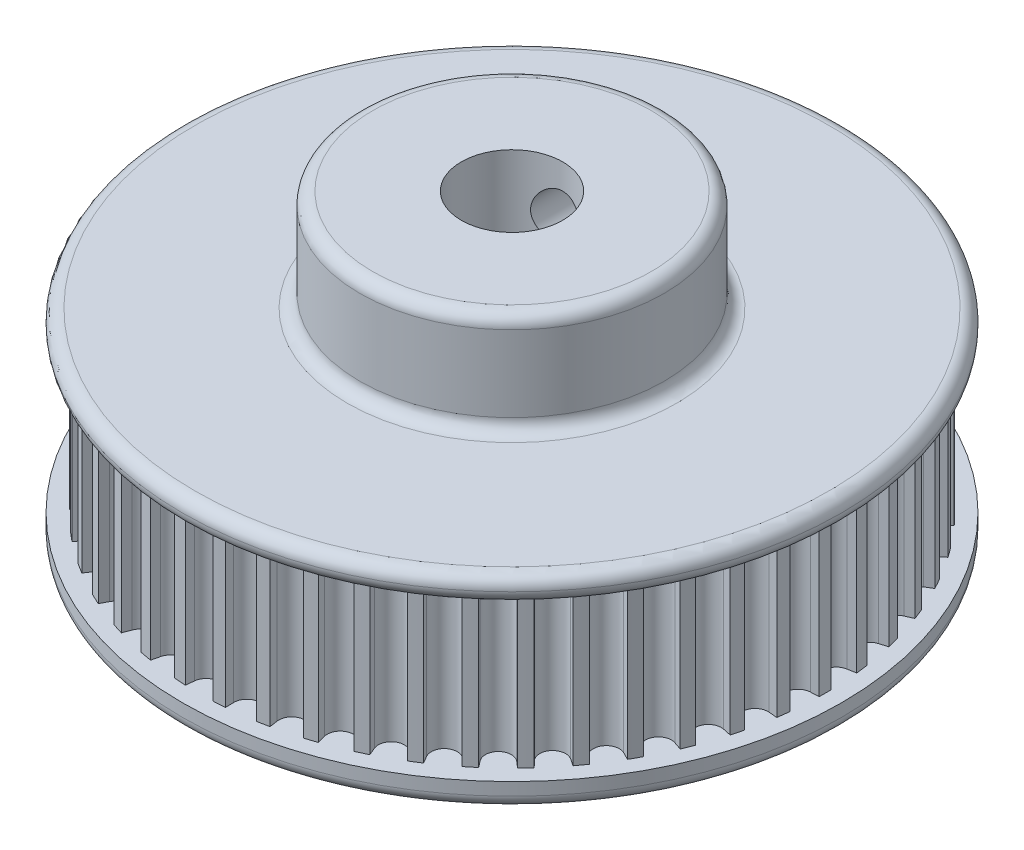
from build123d import *

# Parameters (mm, degrees)
SKETCH1_R               = 39.2176
SKETCH1_R_2             = 6.35
BOSS_EXTRUDE1_DEPTH     = 9.5
CUT_EXTRUDE1_DEPTH      = 57.269799178
CIRPATTERN1_COUNT       = 50
SKETCH2_R               = 41.275
SKETCH2_R_2             = 6.35
BOSS_EXTRUDE2_DEPTH     = 3.175
SKETCH4_R               = 19.05
SKETCH4_R_2             = 6.35
BOSS_EXTRUDE4_DEPTH     = 12.7
CUT_EXTRUDE2_REACH      = 65.649
CUT_EXTRUDE2_END_RADIUS = 19.05
SKETCH5_R               = 3.175
FILLET2_R               = 1.5875


with BuildPart() as part:
    # Sketch1 → Boss-Extrude1 (new, symmetric)
    with BuildSketch(Plane(origin=(0, 0, 0), x_dir=(1, 0, 0), z_dir=(0, 1, 0))):
        with Locations(Location((0, 0, 0), (0, 0, 270))):
            Circle(SKETCH1_R)
        with Locations(Location((0, 0, 0), (0, 0, 270))):
            Circle(SKETCH1_R_2, mode=Mode.SUBTRACT)
    extrude(amount=BOSS_EXTRUDE1_DEPTH, both=True)

    # Sketch1<6> → Cut-Extrude1 (cut, symmetric)
    with BuildSketch(Plane(origin=(0, 0, 0), x_dir=(1, 0, 0), z_dir=(0, 1, 0))):
        with BuildLine():
            Line((1.7272, -39.179547342), (1.616608215, -38.132456801))
            ThreePointArc((1.616608215, -38.132456801), (0, -36.6776), (-1.616608215, -38.132456801))
            Line((-1.616608215, -38.132456801), (-1.7272, -39.179547342))
            ThreePointArc((-1.7272, -39.179547342), (0, -39.2176), (1.7272, -39.179547342))
        make_face()
    cut_extrude1 = extrude(amount=CUT_EXTRUDE1_DEPTH, both=True, mode=Mode.SUBTRACT)

    # CirPattern1: Cut-Extrude1 ×50 about axis
    cirpattern1_axis = Axis((0, 0, 0), (0, 1, 0))
    for i in range(1, CIRPATTERN1_COUNT):
        add(cut_extrude1.rotate(cirpattern1_axis, i * 360 / CIRPATTERN1_COUNT), mode=Mode.SUBTRACT)

    # Sketch2 → Boss-Extrude2 (add)
    with BuildSketch(Plane(origin=(0, 9.5, 0), x_dir=(1, 0, 0), z_dir=(0, 1, 0))):
        with Locations(Location((0, 0, 0), (0, 0, 270))):
            Circle(SKETCH2_R)
        with Locations(Location((0, 0, 0), (0, 0, 270))):
            Circle(SKETCH2_R_2, mode=Mode.SUBTRACT)
    boss_extrude2 = extrude(amount=BOSS_EXTRUDE2_DEPTH)

    # Mirror2: Boss-Extrude2 across plane
    add(boss_extrude2.mirror(Plane.ZX))

    # Sketch4 → Boss-Extrude4 (add)
    with BuildSketch(Plane(origin=(0, 12.675, 0), x_dir=(1, 0, 0), z_dir=(0, 1, 0))):
        with Locations(Location((0, 0, 0), (0, 0, 270))):
            Circle(SKETCH4_R)
        with Locations(Location((0, 0, 0), (0, 0, 270))):
            Circle(SKETCH4_R_2, mode=Mode.SUBTRACT)
    extrude(amount=BOSS_EXTRUDE4_DEPTH)

    # Cut-Extrude2: up to this cylinder (the profile starts inside it)
    cut_extrude2_end = Plane(origin=(0, 19.025, 0), z_dir=(0, -1, 0)) * Cylinder(CUT_EXTRUDE2_END_RADIUS, 170.398, mode=Mode.PRIVATE)
    # Sketch5 → Cut-Extrude2 (cut, up to the surface)
    with BuildSketch(Plane.XY, mode=Mode.PRIVATE) as cut_extrude2_sk1:
        with Locations((0, 19.025)):
            Circle(SKETCH5_R)
    cut_extrude2_tool1 = extrude(cut_extrude2_sk1.sketch, amount=-CUT_EXTRUDE2_REACH, mode=Mode.PRIVATE) & cut_extrude2_end
    add(cut_extrude2_tool1.solids().sort_by_distance((0, 19.025, 0))[0], mode=Mode.SUBTRACT)

    # Fillet2
    fillet2_edges = [part.edges().sort_by_distance(p)[0] for p in [
        (0, 12.675, -41.275),
        (0, 9.5, -41.275),
        (0, -12.675, -41.275),
        (0, 25.375, -19.05),
        (0, 12.675, -19.05),
    ]]
    fillet(fillet2_edges, radius=FILLET2_R - 0.0001)  # a hair under: the kernel refuses the full size


solid = part.part
